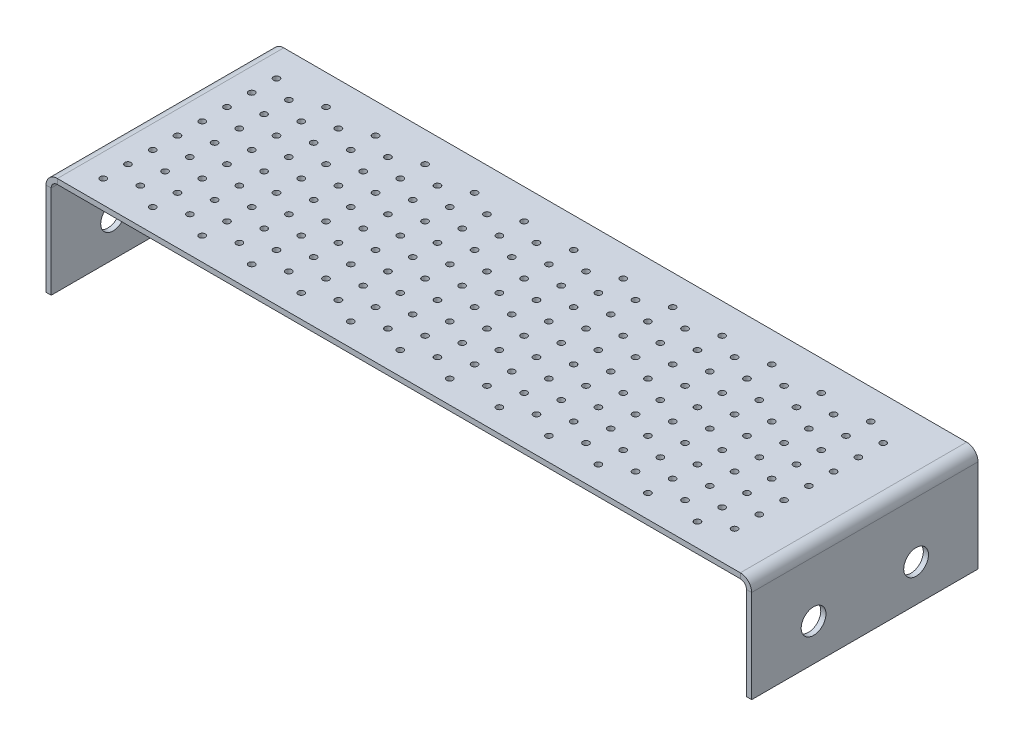
from build123d import *

# Parameters (mm, degrees)
SKETCH1_W                    = 361.95
SKETCH1_H                    = 116.08816
BASE_FLANGE1_DEPTH           = 2.65684
EDGE_FLANGE1_STRIP_W         = 16.97736
EDGE_FLANGE1_STRIP_H         = 2.65684
EDGE_FLANGE1_STRIP_CUT_DEPTH = 116.08816
EDGE_FLANGE1_DEPTH           = 116.08816
EDGE_FLANGE2_STRIP_W         = 16.97736
EDGE_FLANGE2_STRIP_H         = 2.65684
EDGE_FLANGE2_STRIP_CUT_DEPTH = 116.08816
EDGE_FLANGE2_DEPTH           = 116.08816
SKETCH12_R                   = 1.5875
CUT_EXTRUDE1_DEPTH           = 384.851399809
CUT_EXTRUDE2_DEPTH           = 384.851399809
CUT_EXTRUDE2_DEPTH_BACK      = 384.851399809
SKETCH13_R                   = 6.35


# Sheet-metal steps are written as plain solids
with BuildPart() as part:
    # Sketch1 → Base-Flange1 (new body)
    with BuildSketch(Plane(origin=(0, 0, 0), x_dir=(1, 0, 0), z_dir=(0, 1, 0))):
        with Locations((180.975, 58.04408)):
            Rectangle(SKETCH1_W, SKETCH1_H)
    extrude(amount=-BASE_FLANGE1_DEPTH)

    # Edge-Flange1 strip (across the edge) → Edge-Flange1 strip cut (cut)
    with BuildSketch(Plane(origin=(361.95, -2.65684, -116.08816), x_dir=(-1, 0, 0), z_dir=(0, 0, 1))):
        with Locations((-2.65684, -1.32842)):
            Rectangle(EDGE_FLANGE1_STRIP_W, EDGE_FLANGE1_STRIP_H)
    extrude(amount=EDGE_FLANGE1_STRIP_CUT_DEPTH, mode=Mode.SUBTRACT)

    # Edge-Flange1 section (across the edge) → Edge-Flange1 (add)
    with BuildSketch(Plane(origin=(361.95, -2.65684, -116.08816), x_dir=(-1, 0, 0), z_dir=(0, 0, 1))):
        with BuildLine():
            Line((0, 3.175), (0, 50.8))
            Line((0, 50.8), (2.65684, 50.8))
            Line((2.65684, 50.8), (2.65684, 3.175))
            ThreePointArc((2.65684, 3.175), (3.58677597, 0.92993597), (5.83184, 0))
            Line((5.83184, 0), (5.83184, -2.65684))
            ThreePointArc((5.83184, -2.65684), (1.708106389, -0.948733611), (0, 3.175))
        make_face()
    extrude(amount=EDGE_FLANGE1_DEPTH)

    # Edge-Flange2 strip (across the edge) → Edge-Flange2 strip cut (cut)
    with BuildSketch(Plane(origin=(0, -2.65684, 0), x_dir=(1, 0, 0), z_dir=(0, 0, -1))):
        with Locations((-2.65684, -1.32842)):
            Rectangle(EDGE_FLANGE2_STRIP_W, EDGE_FLANGE2_STRIP_H)
    extrude(amount=EDGE_FLANGE2_STRIP_CUT_DEPTH, mode=Mode.SUBTRACT)

    # Edge-Flange2 section (across the edge) → Edge-Flange2 (add)
    with BuildSketch(Plane(origin=(0, -2.65684, 0), x_dir=(1, 0, 0), z_dir=(0, 0, -1))):
        with BuildLine():
            Line((0, 3.175), (0, 50.8))
            Line((0, 50.8), (2.65684, 50.8))
            Line((2.65684, 50.8), (2.65684, 3.175))
            ThreePointArc((2.65684, 3.175), (3.58677597, 0.92993597), (5.83184, 0))
            Line((5.83184, 0), (5.83184, -2.65684))
            ThreePointArc((5.83184, -2.65684), (1.708106389, -0.948733611), (0, 3.175))
        make_face()
    extrude(amount=EDGE_FLANGE2_DEPTH)

    # Sketch12 → Cut-Extrude1 (cut, through all)
    with BuildSketch(Plane(origin=(0, 0, 0), x_dir=(1, 0, 0), z_dir=(0, 1, 0))):
        with Locations(Location((17.57934, 11.7475, 0), (0, 0, 270))):
            Circle(SKETCH12_R)
        with Locations(Location((17.57934, 24.4475, 0), (0, 0, 270))):
            Circle(SKETCH12_R)
        with Locations(Location((17.57934, 37.1475, 0), (0, 0, 270))):
            Circle(SKETCH12_R)
        with Locations(Location((17.57934, 49.8475, 0), (0, 0, 270))):
            Circle(SKETCH12_R)
        with Locations(Location((17.57934, 62.5475, 0), (0, 0, 270))):
            Circle(SKETCH12_R)
        with Locations(Location((17.57934, 75.2475, 0), (0, 0, 270))):
            Circle(SKETCH12_R)
        with Locations(Location((17.57934, 87.9475, 0), (0, 0, 270))):
            Circle(SKETCH12_R)
        with Locations(Location((17.57934, 100.6475, 0), (0, 0, 270))):
            Circle(SKETCH12_R)
        with Locations(Location((42.97934, 11.7475, 0), (0, 0, 270))):
            Circle(SKETCH12_R)
        with Locations(Location((42.97934, 24.4475, 0), (0, 0, 270))):
            Circle(SKETCH12_R)
        with Locations(Location((42.97934, 37.1475, 0), (0, 0, 270))):
            Circle(SKETCH12_R)
        with Locations(Location((42.97934, 49.8475, 0), (0, 0, 270))):
            Circle(SKETCH12_R)
        with Locations(Location((42.97934, 62.5475, 0), (0, 0, 270))):
            Circle(SKETCH12_R)
        with Locations(Location((42.97934, 75.2475, 0), (0, 0, 270))):
            Circle(SKETCH12_R)
        with Locations(Location((42.97934, 87.9475, 0), (0, 0, 270))):
            Circle(SKETCH12_R)
        with Locations(Location((42.97934, 100.6475, 0), (0, 0, 270))):
            Circle(SKETCH12_R)
        with Locations(Location((68.37934, 11.7475, 0), (0, 0, 270))):
            Circle(SKETCH12_R)
        with Locations(Location((68.37934, 24.4475, 0), (0, 0, 270))):
            Circle(SKETCH12_R)
        with Locations(Location((68.37934, 37.1475, 0), (0, 0, 270))):
            Circle(SKETCH12_R)
        with Locations(Location((68.37934, 49.8475, 0), (0, 0, 270))):
            Circle(SKETCH12_R)
        with Locations(Location((68.37934, 62.5475, 0), (0, 0, 270))):
            Circle(SKETCH12_R)
        with Locations(Location((68.37934, 75.2475, 0), (0, 0, 270))):
            Circle(SKETCH12_R)
        with Locations(Location((68.37934, 87.9475, 0), (0, 0, 270))):
            Circle(SKETCH12_R)
        with Locations(Location((68.37934, 100.6475, 0), (0, 0, 270))):
            Circle(SKETCH12_R)
        with Locations(Location((93.77934, 11.7475, 0), (0, 0, 270))):
            Circle(SKETCH12_R)
        with Locations(Location((93.77934, 24.4475, 0), (0, 0, 270))):
            Circle(SKETCH12_R)
        with Locations(Location((93.77934, 37.1475, 0), (0, 0, 270))):
            Circle(SKETCH12_R)
        with Locations(Location((93.77934, 49.8475, 0), (0, 0, 270))):
            Circle(SKETCH12_R)
        with Locations(Location((93.77934, 62.5475, 0), (0, 0, 270))):
            Circle(SKETCH12_R)
        with Locations(Location((93.77934, 75.2475, 0), (0, 0, 270))):
            Circle(SKETCH12_R)
        with Locations(Location((93.77934, 87.9475, 0), (0, 0, 270))):
            Circle(SKETCH12_R)
        with Locations(Location((93.77934, 100.6475, 0), (0, 0, 270))):
            Circle(SKETCH12_R)
        with Locations(Location((119.17934, 11.7475, 0), (0, 0, 270))):
            Circle(SKETCH12_R)
        with Locations(Location((119.17934, 24.4475, 0), (0, 0, 270))):
            Circle(SKETCH12_R)
        with Locations(Location((119.17934, 37.1475, 0), (0, 0, 270))):
            Circle(SKETCH12_R)
        with Locations(Location((119.17934, 49.8475, 0), (0, 0, 270))):
            Circle(SKETCH12_R)
        with Locations(Location((119.17934, 62.5475, 0), (0, 0, 270))):
            Circle(SKETCH12_R)
        with Locations(Location((119.17934, 75.2475, 0), (0, 0, 270))):
            Circle(SKETCH12_R)
        with Locations(Location((119.17934, 87.9475, 0), (0, 0, 270))):
            Circle(SKETCH12_R)
        with Locations(Location((119.17934, 100.6475, 0), (0, 0, 270))):
            Circle(SKETCH12_R)
        with Locations(Location((144.57934, 11.7475, 0), (0, 0, 270))):
            Circle(SKETCH12_R)
        with Locations(Location((144.57934, 24.4475, 0), (0, 0, 270))):
            Circle(SKETCH12_R)
        with Locations(Location((144.57934, 37.1475, 0), (0, 0, 270))):
            Circle(SKETCH12_R)
        with Locations(Location((144.57934, 49.8475, 0), (0, 0, 270))):
            Circle(SKETCH12_R)
        with Locations(Location((144.57934, 62.5475, 0), (0, 0, 270))):
            Circle(SKETCH12_R)
        with Locations(Location((144.57934, 75.2475, 0), (0, 0, 270))):
            Circle(SKETCH12_R)
        with Locations(Location((144.57934, 87.9475, 0), (0, 0, 270))):
            Circle(SKETCH12_R)
        with Locations(Location((144.57934, 100.6475, 0), (0, 0, 270))):
            Circle(SKETCH12_R)
        with Locations(Location((169.97934, 11.7475, 0), (0, 0, 270))):
            Circle(SKETCH12_R)
        with Locations(Location((169.97934, 24.4475, 0), (0, 0, 270))):
            Circle(SKETCH12_R)
        with Locations(Location((169.97934, 37.1475, 0), (0, 0, 270))):
            Circle(SKETCH12_R)
        with Locations(Location((169.97934, 49.8475, 0), (0, 0, 270))):
            Circle(SKETCH12_R)
        with Locations(Location((169.97934, 62.5475, 0), (0, 0, 270))):
            Circle(SKETCH12_R)
        with Locations(Location((169.97934, 75.2475, 0), (0, 0, 270))):
            Circle(SKETCH12_R)
        with Locations(Location((169.97934, 87.9475, 0), (0, 0, 270))):
            Circle(SKETCH12_R)
        with Locations(Location((169.97934, 100.6475, 0), (0, 0, 270))):
            Circle(SKETCH12_R)
        with Locations(Location((195.37934, 11.7475, 0), (0, 0, 270))):
            Circle(SKETCH12_R)
        with Locations(Location((195.37934, 24.4475, 0), (0, 0, 270))):
            Circle(SKETCH12_R)
        with Locations(Location((195.37934, 37.1475, 0), (0, 0, 270))):
            Circle(SKETCH12_R)
        with Locations(Location((195.37934, 49.8475, 0), (0, 0, 270))):
            Circle(SKETCH12_R)
        with Locations(Location((195.37934, 62.5475, 0), (0, 0, 270))):
            Circle(SKETCH12_R)
        with Locations(Location((195.37934, 75.2475, 0), (0, 0, 270))):
            Circle(SKETCH12_R)
        with Locations(Location((195.37934, 87.9475, 0), (0, 0, 270))):
            Circle(SKETCH12_R)
        with Locations(Location((195.37934, 100.6475, 0), (0, 0, 270))):
            Circle(SKETCH12_R)
        with Locations(Location((220.77934, 11.7475, 0), (0, 0, 270))):
            Circle(SKETCH12_R)
        with Locations(Location((220.77934, 24.4475, 0), (0, 0, 270))):
            Circle(SKETCH12_R)
        with Locations(Location((220.77934, 37.1475, 0), (0, 0, 270))):
            Circle(SKETCH12_R)
        with Locations(Location((220.77934, 49.8475, 0), (0, 0, 270))):
            Circle(SKETCH12_R)
        with Locations(Location((220.77934, 62.5475, 0), (0, 0, 270))):
            Circle(SKETCH12_R)
        with Locations(Location((220.77934, 75.2475, 0), (0, 0, 270))):
            Circle(SKETCH12_R)
        with Locations(Location((220.77934, 87.9475, 0), (0, 0, 270))):
            Circle(SKETCH12_R)
        with Locations(Location((220.77934, 100.6475, 0), (0, 0, 270))):
            Circle(SKETCH12_R)
        with Locations(Location((246.17934, 11.7475, 0), (0, 0, 270))):
            Circle(SKETCH12_R)
        with Locations(Location((246.17934, 24.4475, 0), (0, 0, 270))):
            Circle(SKETCH12_R)
        with Locations(Location((246.17934, 37.1475, 0), (0, 0, 270))):
            Circle(SKETCH12_R)
        with Locations(Location((246.17934, 49.8475, 0), (0, 0, 270))):
            Circle(SKETCH12_R)
        with Locations(Location((246.17934, 62.5475, 0), (0, 0, 270))):
            Circle(SKETCH12_R)
        with Locations(Location((246.17934, 75.2475, 0), (0, 0, 270))):
            Circle(SKETCH12_R)
        with Locations(Location((246.17934, 87.9475, 0), (0, 0, 270))):
            Circle(SKETCH12_R)
        with Locations(Location((246.17934, 100.6475, 0), (0, 0, 270))):
            Circle(SKETCH12_R)
        with Locations(Location((271.57934, 11.7475, 0), (0, 0, 270))):
            Circle(SKETCH12_R)
        with Locations(Location((271.57934, 24.4475, 0), (0, 0, 270))):
            Circle(SKETCH12_R)
        with Locations(Location((271.57934, 37.1475, 0), (0, 0, 270))):
            Circle(SKETCH12_R)
        with Locations(Location((271.57934, 49.8475, 0), (0, 0, 270))):
            Circle(SKETCH12_R)
        with Locations(Location((271.57934, 62.5475, 0), (0, 0, 270))):
            Circle(SKETCH12_R)
        with Locations(Location((271.57934, 75.2475, 0), (0, 0, 270))):
            Circle(SKETCH12_R)
        with Locations(Location((271.57934, 87.9475, 0), (0, 0, 270))):
            Circle(SKETCH12_R)
        with Locations(Location((271.57934, 100.6475, 0), (0, 0, 270))):
            Circle(SKETCH12_R)
        with Locations(Location((296.97934, 11.7475, 0), (0, 0, 270))):
            Circle(SKETCH12_R)
        with Locations(Location((296.97934, 24.4475, 0), (0, 0, 270))):
            Circle(SKETCH12_R)
        with Locations(Location((296.97934, 37.1475, 0), (0, 0, 270))):
            Circle(SKETCH12_R)
        with Locations(Location((296.97934, 49.8475, 0), (0, 0, 270))):
            Circle(SKETCH12_R)
        with Locations(Location((296.97934, 62.5475, 0), (0, 0, 270))):
            Circle(SKETCH12_R)
        with Locations(Location((296.97934, 75.2475, 0), (0, 0, 270))):
            Circle(SKETCH12_R)
        with Locations(Location((296.97934, 87.9475, 0), (0, 0, 270))):
            Circle(SKETCH12_R)
        with Locations(Location((296.97934, 100.6475, 0), (0, 0, 270))):
            Circle(SKETCH12_R)
        with Locations(Location((322.37934, 11.7475, 0), (0, 0, 270))):
            Circle(SKETCH12_R)
        with Locations(Location((322.37934, 24.4475, 0), (0, 0, 270))):
            Circle(SKETCH12_R)
        with Locations(Location((322.37934, 37.1475, 0), (0, 0, 270))):
            Circle(SKETCH12_R)
        with Locations(Location((322.37934, 49.8475, 0), (0, 0, 270))):
            Circle(SKETCH12_R)
        with Locations(Location((322.37934, 62.5475, 0), (0, 0, 270))):
            Circle(SKETCH12_R)
        with Locations(Location((322.37934, 75.2475, 0), (0, 0, 270))):
            Circle(SKETCH12_R)
        with Locations(Location((322.37934, 87.9475, 0), (0, 0, 270))):
            Circle(SKETCH12_R)
        with Locations(Location((322.37934, 100.6475, 0), (0, 0, 270))):
            Circle(SKETCH12_R)
        with Locations(Location((30.27934, 18.0975, 0), (0, 0, 270))):
            Circle(SKETCH12_R)
        with Locations(Location((30.27934, 30.7975, 0), (0, 0, 270))):
            Circle(SKETCH12_R)
        with Locations(Location((30.27934, 43.4975, 0), (0, 0, 270))):
            Circle(SKETCH12_R)
        with Locations(Location((30.27934, 56.1975, 0), (0, 0, 270))):
            Circle(SKETCH12_R)
        with Locations(Location((30.27934, 68.8975, 0), (0, 0, 270))):
            Circle(SKETCH12_R)
        with Locations(Location((30.27934, 81.5975, 0), (0, 0, 270))):
            Circle(SKETCH12_R)
        with Locations(Location((30.27934, 94.2975, 0), (0, 0, 270))):
            Circle(SKETCH12_R)
        with Locations(Location((55.67934, 43.4975, 0), (0, 0, 270))):
            Circle(SKETCH12_R)
        with Locations(Location((55.67934, 56.1975, 0), (0, 0, 270))):
            Circle(SKETCH12_R)
        with Locations(Location((55.67934, 68.8975, 0), (0, 0, 270))):
            Circle(SKETCH12_R)
        with Locations(Location((55.67934, 81.5975, 0), (0, 0, 270))):
            Circle(SKETCH12_R)
        with Locations(Location((55.67934, 94.2975, 0), (0, 0, 270))):
            Circle(SKETCH12_R)
        with Locations(Location((55.67934, 30.7975, 0), (0, 0, 270))):
            Circle(SKETCH12_R)
        with Locations(Location((55.67934, 18.0975, 0), (0, 0, 270))):
            Circle(SKETCH12_R)
        with Locations(Location((81.07934, 43.4975, 0), (0, 0, 270))):
            Circle(SKETCH12_R)
        with Locations(Location((81.07934, 56.1975, 0), (0, 0, 270))):
            Circle(SKETCH12_R)
        with Locations(Location((81.07934, 68.8975, 0), (0, 0, 270))):
            Circle(SKETCH12_R)
        with Locations(Location((81.07934, 81.5975, 0), (0, 0, 270))):
            Circle(SKETCH12_R)
        with Locations(Location((81.07934, 94.2975, 0), (0, 0, 270))):
            Circle(SKETCH12_R)
        with Locations(Location((81.07934, 30.7975, 0), (0, 0, 270))):
            Circle(SKETCH12_R)
        with Locations(Location((81.07934, 18.0975, 0), (0, 0, 270))):
            Circle(SKETCH12_R)
        with Locations(Location((106.47934, 43.4975, 0), (0, 0, 270))):
            Circle(SKETCH12_R)
        with Locations(Location((106.47934, 56.1975, 0), (0, 0, 270))):
            Circle(SKETCH12_R)
        with Locations(Location((106.47934, 68.8975, 0), (0, 0, 270))):
            Circle(SKETCH12_R)
        with Locations(Location((106.47934, 81.5975, 0), (0, 0, 270))):
            Circle(SKETCH12_R)
        with Locations(Location((106.47934, 94.2975, 0), (0, 0, 270))):
            Circle(SKETCH12_R)
        with Locations(Location((106.47934, 30.7975, 0), (0, 0, 270))):
            Circle(SKETCH12_R)
        with Locations(Location((106.47934, 18.0975, 0), (0, 0, 270))):
            Circle(SKETCH12_R)
        with Locations(Location((131.87934, 43.4975, 0), (0, 0, 270))):
            Circle(SKETCH12_R)
        with Locations(Location((131.87934, 56.1975, 0), (0, 0, 270))):
            Circle(SKETCH12_R)
        with Locations(Location((131.87934, 68.8975, 0), (0, 0, 270))):
            Circle(SKETCH12_R)
        with Locations(Location((131.87934, 81.5975, 0), (0, 0, 270))):
            Circle(SKETCH12_R)
        with Locations(Location((131.87934, 94.2975, 0), (0, 0, 270))):
            Circle(SKETCH12_R)
        with Locations(Location((131.87934, 30.7975, 0), (0, 0, 270))):
            Circle(SKETCH12_R)
        with Locations(Location((131.87934, 18.0975, 0), (0, 0, 270))):
            Circle(SKETCH12_R)
        with Locations(Location((157.27934, 43.4975, 0), (0, 0, 270))):
            Circle(SKETCH12_R)
        with Locations(Location((157.27934, 56.1975, 0), (0, 0, 270))):
            Circle(SKETCH12_R)
        with Locations(Location((157.27934, 68.8975, 0), (0, 0, 270))):
            Circle(SKETCH12_R)
        with Locations(Location((157.27934, 81.5975, 0), (0, 0, 270))):
            Circle(SKETCH12_R)
        with Locations(Location((157.27934, 94.2975, 0), (0, 0, 270))):
            Circle(SKETCH12_R)
        with Locations(Location((157.27934, 30.7975, 0), (0, 0, 270))):
            Circle(SKETCH12_R)
        with Locations(Location((157.27934, 18.0975, 0), (0, 0, 270))):
            Circle(SKETCH12_R)
        with Locations(Location((182.67934, 43.4975, 0), (0, 0, 270))):
            Circle(SKETCH12_R)
        with Locations(Location((182.67934, 56.1975, 0), (0, 0, 270))):
            Circle(SKETCH12_R)
        with Locations(Location((182.67934, 68.8975, 0), (0, 0, 270))):
            Circle(SKETCH12_R)
        with Locations(Location((182.67934, 81.5975, 0), (0, 0, 270))):
            Circle(SKETCH12_R)
        with Locations(Location((182.67934, 94.2975, 0), (0, 0, 270))):
            Circle(SKETCH12_R)
        with Locations(Location((182.67934, 30.7975, 0), (0, 0, 270))):
            Circle(SKETCH12_R)
        with Locations(Location((182.67934, 18.0975, 0), (0, 0, 270))):
            Circle(SKETCH12_R)
        with Locations(Location((208.07934, 43.4975, 0), (0, 0, 270))):
            Circle(SKETCH12_R)
        with Locations(Location((208.07934, 56.1975, 0), (0, 0, 270))):
            Circle(SKETCH12_R)
        with Locations(Location((208.07934, 68.8975, 0), (0, 0, 270))):
            Circle(SKETCH12_R)
        with Locations(Location((208.07934, 81.5975, 0), (0, 0, 270))):
            Circle(SKETCH12_R)
        with Locations(Location((208.07934, 94.2975, 0), (0, 0, 270))):
            Circle(SKETCH12_R)
        with Locations(Location((208.07934, 30.7975, 0), (0, 0, 270))):
            Circle(SKETCH12_R)
        with Locations(Location((208.07934, 18.0975, 0), (0, 0, 270))):
            Circle(SKETCH12_R)
        with Locations(Location((233.47934, 43.4975, 0), (0, 0, 270))):
            Circle(SKETCH12_R)
        with Locations(Location((233.47934, 56.1975, 0), (0, 0, 270))):
            Circle(SKETCH12_R)
        with Locations(Location((233.47934, 68.8975, 0), (0, 0, 270))):
            Circle(SKETCH12_R)
        with Locations(Location((233.47934, 81.5975, 0), (0, 0, 270))):
            Circle(SKETCH12_R)
        with Locations(Location((233.47934, 94.2975, 0), (0, 0, 270))):
            Circle(SKETCH12_R)
        with Locations(Location((233.47934, 30.7975, 0), (0, 0, 270))):
            Circle(SKETCH12_R)
        with Locations(Location((233.47934, 18.0975, 0), (0, 0, 270))):
            Circle(SKETCH12_R)
        with Locations(Location((258.87934, 43.4975, 0), (0, 0, 270))):
            Circle(SKETCH12_R)
        with Locations(Location((258.87934, 56.1975, 0), (0, 0, 270))):
            Circle(SKETCH12_R)
        with Locations(Location((258.87934, 68.8975, 0), (0, 0, 270))):
            Circle(SKETCH12_R)
        with Locations(Location((258.87934, 81.5975, 0), (0, 0, 270))):
            Circle(SKETCH12_R)
        with Locations(Location((258.87934, 94.2975, 0), (0, 0, 270))):
            Circle(SKETCH12_R)
        with Locations(Location((258.87934, 30.7975, 0), (0, 0, 270))):
            Circle(SKETCH12_R)
        with Locations(Location((258.87934, 18.0975, 0), (0, 0, 270))):
            Circle(SKETCH12_R)
        with Locations(Location((284.27934, 43.4975, 0), (0, 0, 270))):
            Circle(SKETCH12_R)
        with Locations(Location((284.27934, 56.1975, 0), (0, 0, 270))):
            Circle(SKETCH12_R)
        with Locations(Location((284.27934, 68.8975, 0), (0, 0, 270))):
            Circle(SKETCH12_R)
        with Locations(Location((284.27934, 81.5975, 0), (0, 0, 270))):
            Circle(SKETCH12_R)
        with Locations(Location((284.27934, 94.2975, 0), (0, 0, 270))):
            Circle(SKETCH12_R)
        with Locations(Location((284.27934, 30.7975, 0), (0, 0, 270))):
            Circle(SKETCH12_R)
        with Locations(Location((284.27934, 18.0975, 0), (0, 0, 270))):
            Circle(SKETCH12_R)
        with Locations(Location((309.67934, 43.4975, 0), (0, 0, 270))):
            Circle(SKETCH12_R)
        with Locations(Location((309.67934, 56.1975, 0), (0, 0, 270))):
            Circle(SKETCH12_R)
        with Locations(Location((309.67934, 68.8975, 0), (0, 0, 270))):
            Circle(SKETCH12_R)
        with Locations(Location((309.67934, 81.5975, 0), (0, 0, 270))):
            Circle(SKETCH12_R)
        with Locations(Location((309.67934, 94.2975, 0), (0, 0, 270))):
            Circle(SKETCH12_R)
        with Locations(Location((309.67934, 30.7975, 0), (0, 0, 270))):
            Circle(SKETCH12_R)
        with Locations(Location((309.67934, 18.0975, 0), (0, 0, 270))):
            Circle(SKETCH12_R)
        with Locations(Location((335.07934, 43.4975, 0), (0, 0, 270))):
            Circle(SKETCH12_R)
        with Locations(Location((335.07934, 56.1975, 0), (0, 0, 270))):
            Circle(SKETCH12_R)
        with Locations(Location((335.07934, 68.8975, 0), (0, 0, 270))):
            Circle(SKETCH12_R)
        with Locations(Location((335.07934, 81.5975, 0), (0, 0, 270))):
            Circle(SKETCH12_R)
        with Locations(Location((335.07934, 94.2975, 0), (0, 0, 270))):
            Circle(SKETCH12_R)
        with Locations(Location((335.07934, 30.7975, 0), (0, 0, 270))):
            Circle(SKETCH12_R)
        with Locations(Location((335.07934, 18.0975, 0), (0, 0, 270))):
            Circle(SKETCH12_R)
    extrude(amount=-CUT_EXTRUDE1_DEPTH, mode=Mode.SUBTRACT)

    # Sketch13 → Cut-Extrude2 (cut, two sides: drawn at the far end of the back side and taken through both)
    with BuildSketch(Plane(origin=(361.95, 0, 0), x_dir=(0, 0, -1), z_dir=(1, 0, 0)).offset(-CUT_EXTRUDE2_DEPTH_BACK)):
        with Locations(Location((31.75, -34.40684, 0), (0, 0, 90))):
            Circle(SKETCH13_R)
        with Locations(Location((84.33816, -34.40684, 0), (0, 0, 90))):
            Circle(SKETCH13_R)
    extrude(amount=CUT_EXTRUDE2_DEPTH + CUT_EXTRUDE2_DEPTH_BACK, mode=Mode.SUBTRACT)


solid = part.part
